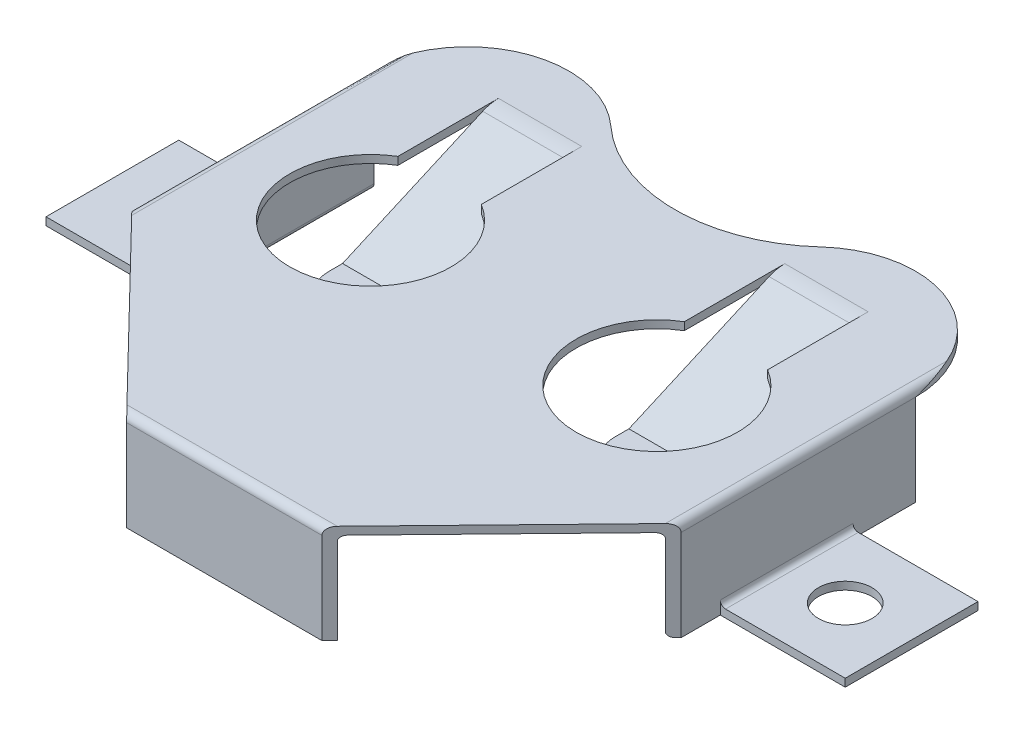
from build123d import *

# Parameters (mm, degrees)
BOSS_EXTRUDE1_DEPTH = 3.8
SHELL1_START        = -21
SHELL1_OUTLINE_W    = 10.25
SHELL1_OUTLINE_H    = 3.5
SHELL1_DEPTH        = 20.7
SHELL1_START_2      = -19.893320937
SHELL1_2_OUTLINE_W  = 1.75
SHELL1_2_OUTLINE_H  = 3.5
SHELL1_2_DEPTH      = 3.893320937
BOSS_EXTRUDE2_DEPTH = 3.2
FILLET1_R           = 1.5
FILLET2_R           = 1.5
SKETCH4_W           = 5.1
SKETCH4_H           = 0.3
BOSS_EXTRUDE3_DEPTH = 4.8
FILLET3_R           = 0.2
SKETCH5_R           = 1.028757753
CUT_EXTRUDE1_DEPTH  = 4.8
FILLET4_R           = 0.2
FILLET5_R           = 0.2
FILLET6_START       = -5
FILLET6_DEPTH       = 10
FILLET6_START_2     = -19.893320937
FILLET6_2_DEPTH     = 13.893320937


with BuildPart() as part:
    # Sketch2 → Boss-Extrude1 (new body)
    with BuildSketch(Plane(origin=(0, 0, 0), x_dir=(1, 0, 0), z_dir=(0, 1, 0))):
        with BuildLine():
            Line((0, 0), (-3.75, 0))
            Line((-3.75, 0), (-10.55, 7))
            Line((-10.55, 7), (-10.55, 16))
            ThreePointArc((-10.55, 16), (-8.229026759, 19.561694912), (-4.03336762, 18.876835935))
            ThreePointArc((-4.03336762, 18.876835935), (-2.162785983, 17.71835226), (0, 17.313980062))
            Line((0, 17.313980062), (0, 0))
        make_face()
        with BuildLine():
            Line((-7.1, 13.769163671), (-7.1, 17.313980062))
            Line((-7.1, 17.313980062), (-3.9, 17.313980062))
            Line((-3.9, 17.313980062), (-3.9, 13.769163671))
            ThreePointArc((-3.9, 13.769163671), (-5.5, 8.013980062), (-7.1, 13.769163671))
        make_face(mode=Mode.SUBTRACT)
    extrude(amount=BOSS_EXTRUDE1_DEPTH)

    # Shell1: read off the stored shape, not the designer's step
    # Shell1 outline → Shell1 (cut)
    with BuildSketch(Plane.XY.offset(SHELL1_START)):
        with Locations((-5.125, 1.75)):
            Rectangle(SHELL1_OUTLINE_W, SHELL1_OUTLINE_H)
    extrude(amount=SHELL1_DEPTH, mode=Mode.SUBTRACT)

    # Shell1 2 outline → Shell1 2 (cut)
    with BuildSketch(Plane.XY.offset(SHELL1_START_2)):
        with Locations((-11.125, 1.75)):
            Rectangle(SHELL1_2_OUTLINE_W, SHELL1_2_OUTLINE_H)
    extrude(amount=SHELL1_2_DEPTH, mode=Mode.SUBTRACT)

    # Sketch3 → Boss-Extrude2 (add)
    with BuildSketch(Plane(origin=(-7.1, 0, 0), x_dir=(0, 0, -1), z_dir=(1, 0, 0))):
        Polygon((17.313980062, 3.5), (11.640356881, 1), (9.614191522, 1), (9.614191522, 1.3), (11.640356881, 1.3), (17.313980062, 3.8), align=None)
    extrude(amount=BOSS_EXTRUDE2_DEPTH)

    # Fillet1
    fillet1_edges = [part.edges().sort_by_distance(p)[0] for p in [
        (-3.9, 1.15, -9.614191522),
        (-7.1, 1.15, -9.614191522),
    ]]
    fillet(fillet1_edges, radius=FILLET1_R)

    # Fillet2
    fillet2_edges = [part.edges().sort_by_distance(p)[0] for p in [
        (-5.5, 3.8, -17.313980062),
        (-5.5, 3.5, -17.313980062),
    ]]
    fillet(fillet2_edges, radius=FILLET2_R)

    # Sketch4 → Boss-Extrude3 (add)
    with BuildSketch(Plane.ZY.offset(10.55)):
        with Locations((-11.05, 0.15)):
            Rectangle(SKETCH4_W, SKETCH4_H)
    extrude(amount=BOSS_EXTRUDE3_DEPTH)

    # Fillet3
    fillet3_edges = [part.edges().sort_by_distance(p)[0] for p in [
        (-10.55, 0.3, -11.05),
    ]]
    fillet(fillet3_edges, radius=FILLET3_R)

    # Sketch5 → Cut-Extrude1 (cut)
    with BuildSketch(Plane(origin=(0, 0.3, 0), x_dir=(1, 0, 0), z_dir=(0, 1, 0))):
        with Locations(Location((-12.85, 11, 0), (0, 0, 270))):
            Circle(SKETCH5_R)
    extrude(amount=-CUT_EXTRUDE1_DEPTH, mode=Mode.SUBTRACT)

    # Fillet4
    fillet4_edges = [part.edges().sort_by_distance(p)[0] for p in [
        (-10.25, 0, -11.345588235),
    ]]
    fillet(fillet4_edges, radius=FILLET4_R)

    # Mirror1: part across plane


with BuildPart() as part_1:
    add(part.part)
    add(part.part.mirror(Plane(origin=(0, 3.8, -17.313980062), x_dir=(0, 0, 1), z_dir=(-1, 0, 0))))

    # Fillet5
    fillet5_edges = [part_1.edges().sort_by_distance(p)[0] for p in [
        (10.25, 3.5, -11.345588235),
        (-10.25, 3.5, -11.345588235),
        (0, 3.5, -0.3),
    ]]
    fillet(fillet5_edges, radius=FILLET5_R)

    # Fillet6: read off the stored shape, not the designer's step
    # Fillet6 outline → Fillet6 (cut)
    with BuildSketch(Plane.YZ.offset(FILLET6_START)):
        with BuildLine():
            ThreePointArc((3.5, 0), (3.712132034, -0.087867966), (3.8, -0.3))
            Line((3.8, -0.3), (3.8, 0))
            Line((3.8, 0), (3.5, 0))
        make_face()
    extrude(amount=FILLET6_DEPTH, mode=Mode.SUBTRACT)

    # Fillet6 2 outline → Fillet6 2 (cut)
    with BuildSketch(Plane.XY.offset(FILLET6_START_2)):
        with BuildLine():
            Line((10.55, 3.8), (10.25, 3.8))
            ThreePointArc((10.25, 3.8), (10.462132034, 3.712132034), (10.55, 3.5))
            Line((10.55, 3.5), (10.55, 3.8))
        make_face()
        with BuildLine():
            ThreePointArc((-10.55, 3.5), (-10.462132034, 3.712132034), (-10.25, 3.8))
            Line((-10.25, 3.8), (-10.55, 3.8))
            Line((-10.55, 3.8), (-10.55, 3.5))
        make_face()
    extrude(amount=FILLET6_2_DEPTH, mode=Mode.SUBTRACT)


solid = part_1.part
